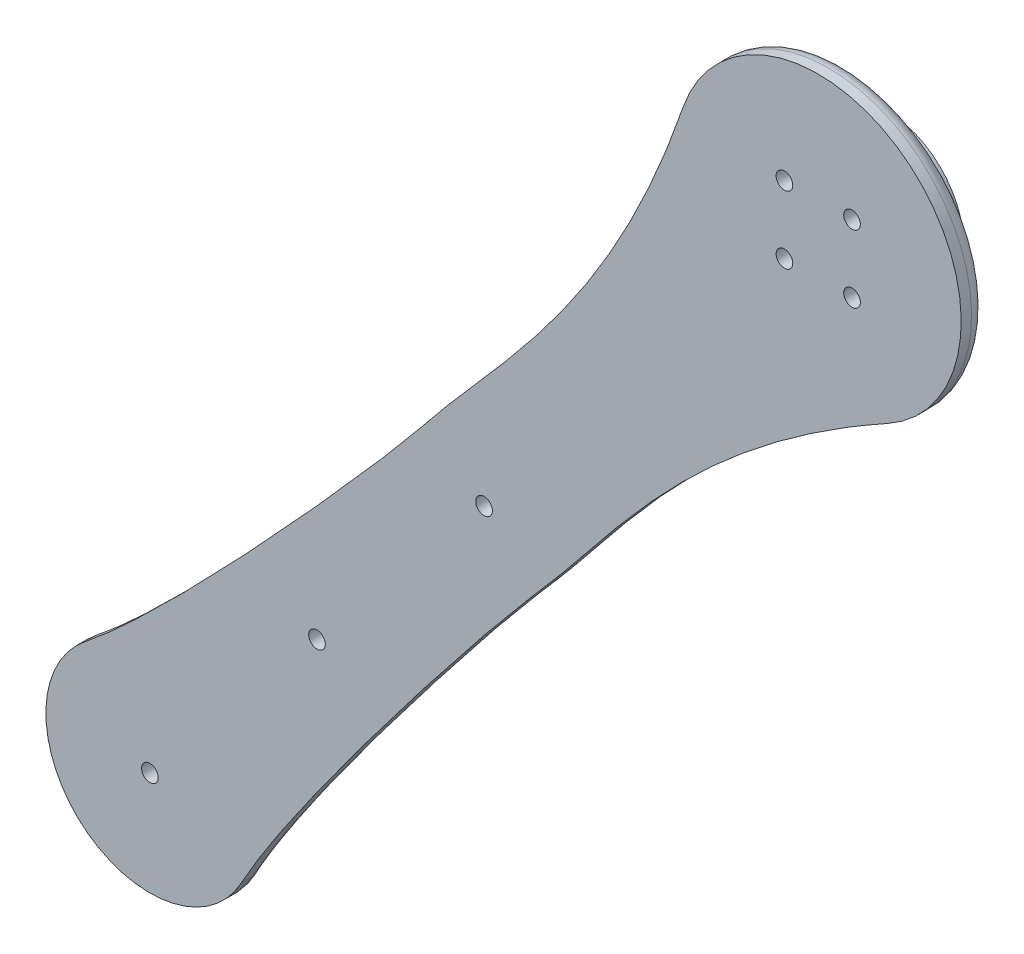
from build123d import *

# Parameters (mm, degrees)
SKETCH1_R           = 1.6
BOSS_EXTRUDE1_DEPTH = 5
SKETCH2_R           = 16
SKETCH2_R_2         = 1.6
BOSS_EXTRUDE2_DEPTH = 1
BOSS_EXTRUDE3_START = 7
SKETCH3_R           = 15
SKETCH3_R_2         = 1.6
BOSS_EXTRUDE3_DEPTH = 7
SKETCH4_R           = 3.75
CUT_EXTRUDE1_DEPTH  = 3
VARFILLET2_R        = 3


with BuildPart() as part:
    # Sketch1 → Boss-Extrude1 (new body)
    with BuildSketch(Plane.XY.offset(11)):
        with BuildLine():
            ThreePointArc((155.019115612, -142.985112199), (159.394881243, -97.849485606), (115.704809966, -109.996492831))
            add(Edge.make_bspline(
                [(115.704809966, -109.996492831), (101.94879758, -150.116707379), (78.178790791, -171.772825461), (58.717079478, -197.082387325), (16.356999542, -244.049515564), (0.72448619, -256.46124476)],
                knots=[0, 0, 0, 0, 0.619090324, 0.719090324, 1, 1, 1, 1], degree=3))
            ThreePointArc((0.72448619, -256.46124476), (0.304947846, -287.445485278), (30.74561606, -281.651963762))
            add(Edge.make_bspline(
                [(155.019115612, -142.985112199), (117.897123756, -163.498941991), (100.69762913, -190.668374405), (79.152067085, -214.229377889), (40.254225745, -264.101669257), (30.74561606, -281.651963762)],
                knots=[0, 0, 0, 0, 0.619090324, 0.719090324, 1, 1, 1, 1], degree=3))
        make_face()
        with Locations((135.218221977, -112.415707792)):
            Circle(SKETCH1_R, mode=Mode.SUBTRACT)
        with Locations((148.218221977, -112.415707792)):
            Circle(SKETCH1_R, mode=Mode.SUBTRACT)
        with Locations((148.218221977, -125.415707792)):
            Circle(SKETCH1_R, mode=Mode.SUBTRACT)
        with Locations((135.218221977, -125.415707792)):
            Circle(SKETCH1_R, mode=Mode.SUBTRACT)
        with Locations((77.439461008, -195.520152104)):
            Circle(SKETCH1_R, mode=Mode.SUBTRACT)
        with Locations((45.300080524, -233.82237426)):
            Circle(SKETCH1_R, mode=Mode.SUBTRACT)
        with Locations((13.16070004, -272.124596416)):
            Circle(SKETCH1_R, mode=Mode.SUBTRACT)
    extrude(amount=BOSS_EXTRUDE1_DEPTH)

    # VarFillet2
    varfillet2_edges = [part.edges().sort_by_distance(p)[0] for p in [
        (65.360846316, -188.427744165, 11),
        (86.521548764, -206.183681785, 11),
    ]]
    fillet(varfillet2_edges, radius=VARFILLET2_R)


with BuildPart() as body_2:
    # Sketch2 → Boss-Extrude2 (new body)
    with BuildSketch(Plane(origin=(0, 0, 11), x_dir=(-1, 0, 0), z_dir=(0, 0, -1))):
        with Locations((-141.718221977, -118.915707792)):
            Circle(SKETCH2_R)
        with Locations((-148.218221977, -125.415707792)):
            Circle(SKETCH2_R_2, mode=Mode.SUBTRACT)
        with Locations((-135.218221977, -125.415707792)):
            Circle(SKETCH2_R_2, mode=Mode.SUBTRACT)
        with Locations((-148.218221977, -112.415707792)):
            Circle(SKETCH2_R_2, mode=Mode.SUBTRACT)
        with Locations((-135.218221977, -112.415707792)):
            Circle(SKETCH2_R_2, mode=Mode.SUBTRACT)
    extrude(amount=BOSS_EXTRUDE2_DEPTH)

    # Sketch3 → Boss-Extrude3 (add)
    with BuildSketch(Plane(origin=(0, 0, 10), x_dir=(-1, 0, 0), z_dir=(0, 0, -1)).offset(BOSS_EXTRUDE3_START)):
        with Locations((-141.718221977, -118.915707792)):
            Circle(SKETCH3_R)
        with Locations((-148.218221977, -125.415707792)):
            Circle(SKETCH3_R_2, mode=Mode.SUBTRACT)
        with Locations((-135.218221977, -125.415707792)):
            Circle(SKETCH3_R_2, mode=Mode.SUBTRACT)
        with Locations((-148.218221977, -112.415707792)):
            Circle(SKETCH3_R_2, mode=Mode.SUBTRACT)
        with Locations((-135.218221977, -112.415707792)):
            Circle(SKETCH3_R_2, mode=Mode.SUBTRACT)
    extrude(amount=-BOSS_EXTRUDE3_DEPTH)

    # Sketch4 → Cut-Extrude1 (cut)
    with BuildSketch(Plane(origin=(0, 0, 3), x_dir=(-1, 0, 0), z_dir=(0, 0, -1))):
        with Locations((-148.218221977, -112.415707792)):
            Circle(SKETCH4_R)
        with Locations((-135.218221977, -112.415707792)):
            Circle(SKETCH4_R)
        with Locations((-135.218221977, -125.415707792)):
            Circle(SKETCH4_R)
        with Locations((-148.218221977, -125.415707792)):
            Circle(SKETCH4_R)
    extrude(amount=-CUT_EXTRUDE1_DEPTH, mode=Mode.SUBTRACT)


solid = Compound([part.part, body_2.part])
